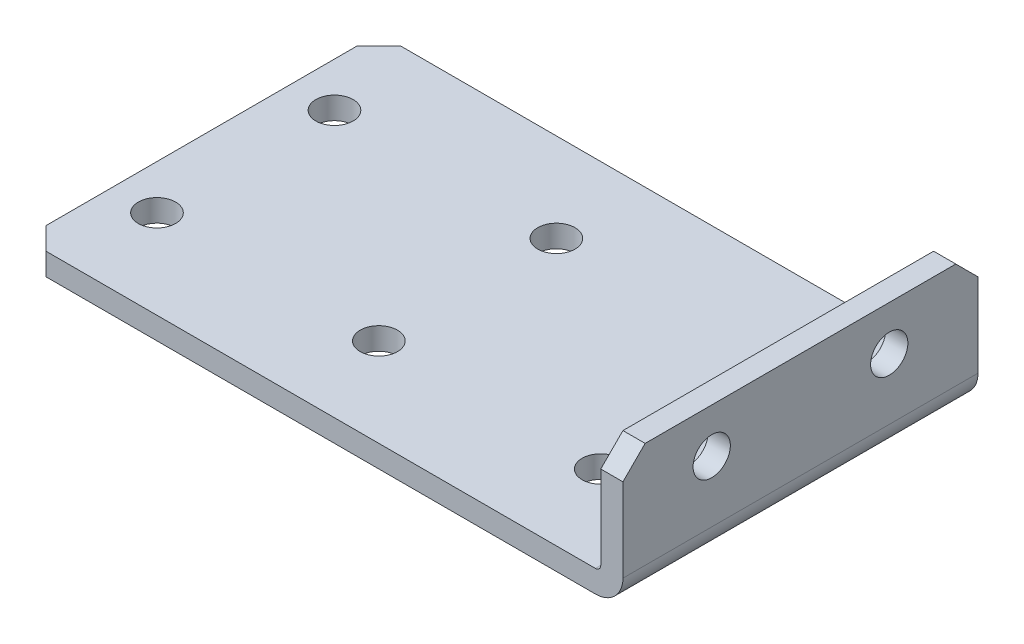
from build123d import *

# Parameters (mm, degrees)
SKETCH1_W               = 81.788
SKETCH1_H               = 63.5
BOSS_EXTRUDE1_DEPTH     = 3.175
EDGE_FLANGE1_DEPTH      = 63.5
SKETCH6_R               = 2.667
CUT_EXTRUDE1_DEPTH      = 108.856577222
SKETCH7_R               = 2.667
CUT_EXTRUDE2_DEPTH      = 106.875658203
CUT_EXTRUDE3_DEPTH      = 108.856577222
CUT_EXTRUDE3_DEPTH_BACK = 108.856577222
SKETCH8_W               = 104.248957023
SKETCH8_H               = 23.686680931
CHAMFER2_SIZE           = 3.175


# Sheet-metal steps are written as plain solids
with BuildPart() as part:
    # Sketch1 → Boss-Extrude1 (new body)
    with BuildSketch(Plane(origin=(0, 0, 0), x_dir=(1, 0, 0), z_dir=(0, 1, 0))):
        with Locations((40.894, 31.75)):
            Rectangle(SKETCH1_W, SKETCH1_H)
    extrude(amount=BOSS_EXTRUDE1_DEPTH)

    # Edge-Flange1 section (across the edge) → Edge-Flange1 (add)
    with BuildSketch(Plane(origin=(82.55, 3.175, 0), x_dir=(-1, 0, 0), z_dir=(0, 0, -1))):
        with BuildLine():
            Line((-3.175, 0.762), (-3.175, 15.875))
            Line((-3.175, 15.875), (0, 15.875))
            Line((0, 15.875), (0, 0.762))
            ThreePointArc((0, 0.762), (0.223184633, 0.223184633), (0.762, 0))
            Line((0.762, 0), (0.762, -3.175))
            ThreePointArc((0.762, -3.175), (-2.021879398, -2.021879398), (-3.175, 0.762))
        make_face()
    extrude(amount=EDGE_FLANGE1_DEPTH)

    # Sketch6 → Cut-Extrude1 (cut, through all)
    with BuildSketch(Plane(origin=(0, 3.175, 0), x_dir=(1, 0, 0), z_dir=(0, 1, 0))):
        with Locations(Location((6.35, 50.8, 0), (0, 0, 270))):
            Circle(SKETCH6_R)
        with Locations(Location((6.35, 25.4, 0), (0, 0, 270))):
            Circle(SKETCH6_R)
        with Locations((6.35, 0)):
            Circle(SKETCH6_R)
        with Locations(Location((69.85, 50.8, 0), (0, 0, 270))):
            Circle(SKETCH6_R)
        with Locations(Location((69.85, 25.4, 0), (0, 0, 270))):
            Circle(SKETCH6_R)
        with Locations((69.85, 0)):
            Circle(SKETCH6_R)
        with Locations(Location((38.1, 50.8, 0), (0, 0, 270))):
            Circle(SKETCH6_R)
        with Locations((38.1, 0)):
            Circle(SKETCH6_R)
        with Locations(Location((38.1, 25.4, 0), (0, 0, 270))):
            Circle(SKETCH6_R)
    extrude(amount=-CUT_EXTRUDE1_DEPTH, mode=Mode.SUBTRACT)

    # Sketch7 → Cut-Extrude2 (cut, through all)
    with BuildSketch(Plane.ZY.offset(-82.55)):
        with Locations(Location((-50.8, 12.7, 0), (0, 0, 270))):
            Circle(SKETCH7_R)
        with Locations(Location((-25.4, 12.7, 0), (0, 0, 270))):
            Circle(SKETCH7_R)
        with Locations((0, 12.7)):
            Circle(SKETCH7_R)
    extrude(amount=-CUT_EXTRUDE2_DEPTH, mode=Mode.SUBTRACT)

    # Sketch8 → Cut-Extrude3 (cut, two sides: drawn at the far end of the back side and taken through both)
    with BuildSketch(Plane(origin=(0, 3.175, 0), x_dir=(1, 0, 0), z_dir=(0, 1, 0)).offset(-CUT_EXTRUDE3_DEPTH_BACK)):
        with Locations((42.695076622, 0.856659535)):
            Rectangle(SKETCH8_W, SKETCH8_H)
    extrude(amount=CUT_EXTRUDE3_DEPTH + CUT_EXTRUDE3_DEPTH_BACK, mode=Mode.SUBTRACT)

    # Chamfer2
    chamfer2_edges = [part.edges().sort_by_distance(p)[0] for p in [
        (84.1375, 19.05, -12.7),
        (0, 1.5875, -12.7),
        (84.1375, 19.05, -63.5),
        (0, 1.5875, -63.5),
    ]]
    chamfer(chamfer2_edges, length=CHAMFER2_SIZE)


solid = part.part
